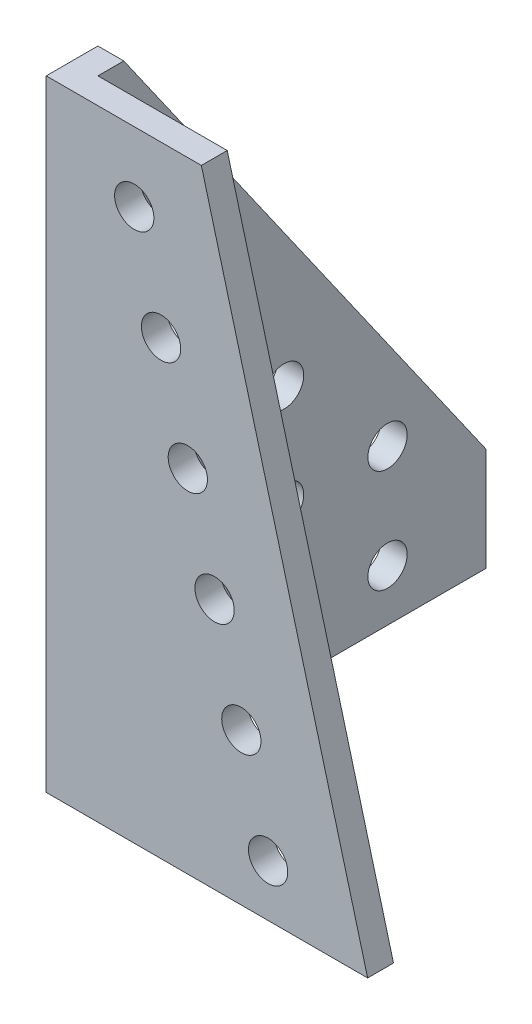
from build123d import *

# Parameters (mm, degrees)
BOSS_EXTRUDE1_DEPTH = 76.2
SKETCH2_R           = 2.413
CUT_EXTRUDE1_DEPTH  = 104.224128115
SKETCH3_R           = 2.413
CUT_EXTRUDE2_DEPTH  = 99.510111863


with BuildPart() as part:
    # Sketch1 → Boss-Extrude1 (new body)
    with BuildSketch(Plane(origin=(0, 0, 0), x_dir=(1, 0, 0), z_dir=(0, 1, 0))):
        Polygon((0, 0), (0, 50.8), (3.175, 50.8), (3.175, 3.175), (50.8, 3.175), (50.8, 0), align=None)
    extrude(amount=BOSS_EXTRUDE1_DEPTH)

    # Sketch2 → Cut-Extrude1 (cut, through all)
    with BuildSketch(Plane(origin=(0, 0, -3.175), x_dir=(-1, 0, 0), z_dir=(0, 0, -1))):
        with Locations((-27.247845098, 6.35)):
            Circle(SKETCH2_R)
        with Locations((-23.960843226, 18.617257994)):
            Circle(SKETCH2_R)
        with Locations((-20.673841353, 30.884515988)):
            Circle(SKETCH2_R)
        with Locations((-17.38683948, 43.151773982)):
            Circle(SKETCH2_R)
        with Locations((-14.099837607, 55.419031975)):
            Circle(SKETCH2_R)
        with Locations((-10.812835734, 67.686289969)):
            Circle(SKETCH2_R)
        Polygon((-19.05, 76.2), (-50.8, -42.29261314), (-50.8, 76.2), align=None)
    extrude(amount=-CUT_EXTRUDE1_DEPTH, mode=Mode.SUBTRACT)

    # Sketch3 → Cut-Extrude2 (cut, through all)
    with BuildSketch(Plane(origin=(3.175, 0, 0), x_dir=(0, 0, -1), z_dir=(1, 0, 0))):
        with Locations((13.335, 6.35)):
            Circle(SKETCH3_R)
        with Locations((26.035, 6.35)):
            Circle(SKETCH3_R)
        with Locations((13.335, 19.05)):
            Circle(SKETCH3_R)
        with Locations((26.035, 19.05)):
            Circle(SKETCH3_R)
        with Locations((13.335, 31.75)):
            Circle(SKETCH3_R)
        with Locations((26.035, 31.75)):
            Circle(SKETCH3_R)
        with Locations((13.335, 44.45)):
            Circle(SKETCH3_R)
        with Locations((38.735, 19.05)):
            Circle(SKETCH3_R)
        with Locations((38.735, 6.35)):
            Circle(SKETCH3_R)
        Polygon((6.35, 76.2), (50.8, 12.7188211), (50.8, 76.2), align=None)
    extrude(amount=-CUT_EXTRUDE2_DEPTH, mode=Mode.SUBTRACT)


solid = part.part
